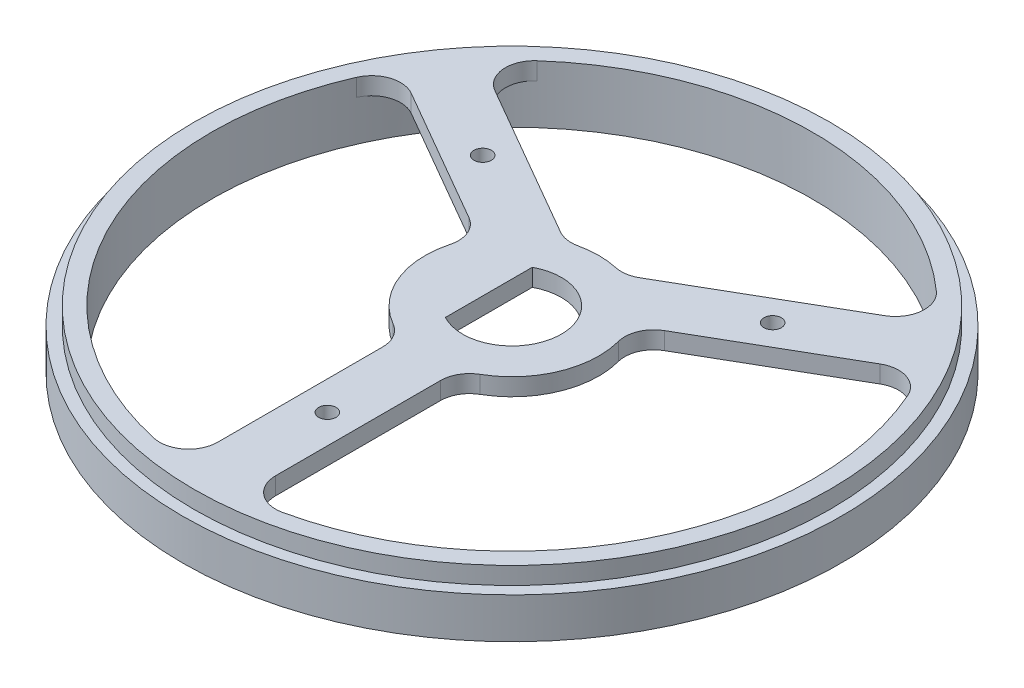
from build123d import *

# Parameters (mm, degrees)
SKETCH1_R           = 56.84006118
SKETCH1_R_2         = 51.85
BOSS_EXTRUDE1_DEPTH = 7
SKETCH2_R           = 54.85
SKETCH2_R_2         = 51.85
BOSS_EXTRUDE2_DEPTH = 3
BOSS_EXTRUDE3_START = -3
SKETCH3_R           = 1.5
BOSS_EXTRUDE3_DEPTH = 3
FILLET1_R           = 5
FILLET2_R           = 5


with BuildPart() as part:
    # Sketch1 → Boss-Extrude1 (new body)
    with BuildSketch(Plane(origin=(0, 0, 0), x_dir=(1, 0, 0), z_dir=(0, 1, 0))):
        Circle(SKETCH1_R)
        Circle(SKETCH1_R_2, mode=Mode.SUBTRACT)
    extrude(amount=BOSS_EXTRUDE1_DEPTH)

    # Sketch2 → Boss-Extrude2 (add)
    with BuildSketch(Plane(origin=(0, 7, 0), x_dir=(1, 0, 0), z_dir=(0, 1, 0))):
        Circle(SKETCH2_R)
        Circle(SKETCH2_R_2, mode=Mode.SUBTRACT)
    extrude(amount=BOSS_EXTRUDE2_DEPTH)

    # Sketch3 → Boss-Extrude3 (add)
    with BuildSketch(Plane(origin=(0, 10, 0), x_dir=(1, 0, 0), z_dir=(0, 1, 0)).offset(BOSS_EXTRUDE3_START)):
        with BuildLine():
            Line((-5, -14.142135624), (-5, -51.608356881))
            ThreePointArc((-5, -51.608356881), (0, -51.85), (5, -51.608356881))
            Line((5, -51.608356881), (5, -14.142135624))
            ThreePointArc((5, -14.142135624), (14.02732958, -5.313569879), (13.114815337, 7.280221059))
            Line((13.114815337, 7.280221059), (45.029160165, 25.705976637))
            ThreePointArc((45.029160165, 25.705976637), (42.328074373, 29.945894876), (39.229079496, 33.904303885))
            Line((39.229079496, 33.904303885), (5, 14.142135624))
            ThreePointArc((5, 14.142135624), (0, 15), (-5, 14.142135624))
            Line((-5, 14.142135624), (-39.229079496, 33.904303885))
            ThreePointArc((-39.229079496, 33.904303885), (-42.328074373, 29.945894876), (-45.029160165, 25.705976637))
            Line((-45.029160165, 25.705976637), (-13.114815337, 7.280221059))
            ThreePointArc((-13.114815337, 7.280221059), (-14.02732958, -5.313569879), (-5, -14.142135624))
        make_face()
        with Locations((-25.007566297, 19.945894876)):
            Circle(SKETCH3_R, mode=Mode.SUBTRACT)
        with Locations((25.007566297, 19.945894876)):
            Circle(SKETCH3_R, mode=Mode.SUBTRACT)
        with Locations((0, -31.85)):
            Circle(SKETCH3_R, mode=Mode.SUBTRACT)
        with BuildLine():
            Line((-4, 0), (-4, 7.5))
            ThreePointArc((-4, 7.5), (8.5, 0), (-4, -7.5))
            Line((-4, -7.5), (-4, 0))
        make_face(mode=Mode.SUBTRACT)
    extrude(amount=BOSS_EXTRUDE3_DEPTH)

    # Fillet1
    fillet1_edges = [part.edges().sort_by_distance(p)[0] for p in [
        (45.029160165, 8.5, -25.705976637),
        (5, 8.5, 51.608356881),
        (13.114815337, 8.5, -7.280221059),
        (5, 8.5, 14.142135624),
    ]]
    fillet(fillet1_edges, radius=FILLET1_R)

    # Fillet2
    fillet2_edges = [part.edges().sort_by_distance(p)[0] for p in [
        (39.229079496, 8.5, -33.904303885),
        (5, 8.5, -14.142135624),
        (-5, 8.5, -14.142135624),
        (-39.229079496, 8.5, -33.904303885),
        (-45.029160165, 8.5, -25.705976637),
        (-13.114815337, 8.5, -7.280221059),
        (-5, 8.5, 14.142135624),
        (-5, 8.5, 51.608356881),
    ]]
    fillet(fillet2_edges, radius=FILLET2_R)


solid = part.part
